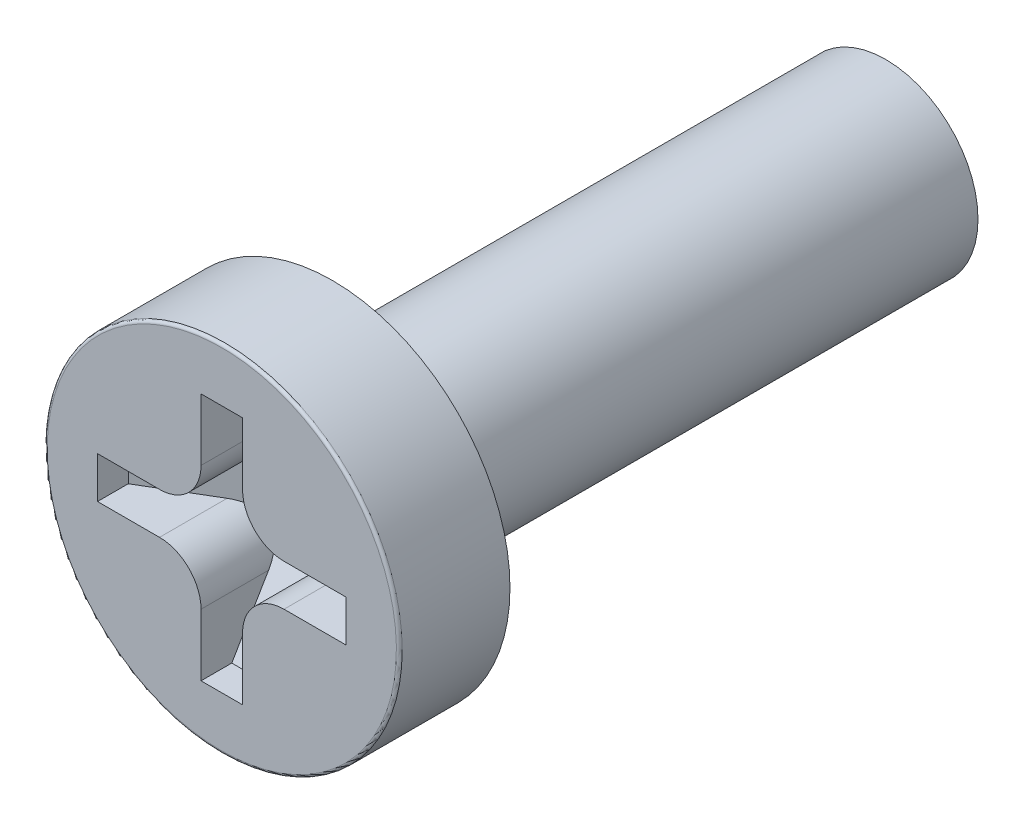
from build123d import *

# Parameters (mm, degrees)
SKETCH_1_W          = 1.925
SKETCH_1_H          = 1.2
CUT_EXTRUDE_1_DEPTH = 1
SKETCH_3_W          = 0.8975
SKETCH_3_H          = 0.13363029
EXTRUDE_1_DEPTH     = 0.45
SKETCH_4_W          = 0.13363029
SKETCH_4_H          = 0.8975
EXTRUDE_2_DEPTH     = 0.45
SKETCH_5_W          = 0.8975
SKETCH_5_H          = 0.13363029
EXTRUDE_3_DEPTH     = 0.45
SKETCH_6_W          = 0.13363029
SKETCH_6_H          = 0.8975
EXTRUDE_4_DEPTH     = 0.45
SKETCH_7_R          = 1
EXTRUDE_5_DEPTH     = 6
DRAFT_1_ANGLE       = 30.706601503
DRAFT_2_ANGLE       = 30.706601503
DRAFT_3_ANGLE       = 30.706601503
DRAFT_4_ANGLE       = 30.706601503
FILLET_1_R          = 0.031496063
FILLET_2_R          = 0.45


with BuildPart() as part:
    # 草图1 → 旋转1 (revolve)
    with BuildSketch(Plane.XZ, mode=Mode.PRIVATE) as revolve_1_sk:
        with Locations((0.9625, 0.6)):
            Rectangle(SKETCH_1_W, SKETCH_1_H)
    revolve(revolve_1_sk.sketch.rotate(Axis((0, 0, 1.2), (0, 0, -1)), 270), axis=Axis((0, 0, 1.2), (0, 0, -1)))

    # 草图2 → 切除-拉伸1 (cut)
    with BuildSketch(Plane.XY.offset(1.2)):
        Polygon((0.225, 1.3475), (-0.225, 1.3475), (-0.225, 0.225), (-1.3475, 0.225), (-1.3475, -0.225), (-0.225, -0.225), (-0.225, -1.3475), (0.225, -1.3475), (0.225, -0.225), (1.3475, -0.225), (1.3475, 0.225), (0.225, 0.225), align=None)
    extrude(amount=-CUT_EXTRUDE_1_DEPTH, mode=Mode.SUBTRACT)

    # 草图3 → 凸台-拉伸1 (add)
    with BuildSketch(Plane.XZ.offset(-0.225)):
        with Locations((-0.89875, 0.266815145)):
            Rectangle(SKETCH_3_W, SKETCH_3_H)
    extrude(amount=EXTRUDE_1_DEPTH)

    # 草图4 → 凸台-拉伸2 (add)
    with BuildSketch(Plane(origin=(-0.225, 0, 0), x_dir=(0, 0, -1), z_dir=(1, 0, 0))):
        with Locations((-0.266815145, 0.89875)):
            Rectangle(SKETCH_4_W, SKETCH_4_H)
    extrude(amount=EXTRUDE_2_DEPTH)

    # 草图5 → 凸台-拉伸3 (add)
    with BuildSketch(Plane.XZ.offset(-0.225)):
        with Locations((0.89875, 0.266815145)):
            Rectangle(SKETCH_5_W, SKETCH_5_H)
    extrude(amount=EXTRUDE_3_DEPTH)

    # 草图6 → 凸台-拉伸4 (add)
    with BuildSketch(Plane(origin=(-0.225, 0, 0), x_dir=(0, 0, -1), z_dir=(1, 0, 0))):
        with Locations((-0.266815145, -0.89875)):
            Rectangle(SKETCH_6_W, SKETCH_6_H)
    extrude(amount=EXTRUDE_4_DEPTH)

    # 草图7 → 凸台-拉伸5 (add)
    with BuildSketch(Plane(origin=(0, 0, 0), x_dir=(-1, 0, 0), z_dir=(0, 0, -1))):
        with Locations(Location((0, 0, 0), (0, 0, 90))):
            Circle(SKETCH_7_R)
    extrude(amount=EXTRUDE_5_DEPTH)

    # 拔模1
    draft_1_faces = [part.faces().sort_by_distance(p)[0] for p in [
        (0, 0.89875, 0.33363029),
    ]]
    draft(draft_1_faces, Plane(origin=(0.225, 0.45, 0.2), x_dir=(0, 0, -1), z_dir=(0, -1, 0)), DRAFT_1_ANGLE)

    # 拔模2
    draft_2_faces = [part.faces().sort_by_distance(p)[0] for p in [
        (0.89875, 0, 0.33363029),
    ]]
    draft(draft_2_faces, Plane(origin=(0.45, -0.225, 0.2), x_dir=(0, 0, -1), z_dir=(-1, 0, 0)), DRAFT_2_ANGLE)

    # 拔模3
    draft_3_faces = [part.faces().sort_by_distance(p)[0] for p in [
        (0, -0.89875, 0.33363029),
    ]]
    draft(draft_3_faces, Plane(origin=(0.225, -0.45, 0.33363029), x_dir=(0, 0, 1), z_dir=(0, 1, 0)), DRAFT_3_ANGLE)

    # 拔模4
    draft_4_faces = [part.faces().sort_by_distance(p)[0] for p in [
        (-0.89875, 0, 0.33363029),
    ]]
    draft(draft_4_faces, Plane(origin=(-0.45, -0.225, 0.33363029), x_dir=(0, 0, 1), z_dir=(1, 0, 0)), DRAFT_4_ANGLE)

    # 圆角1
    fillet_1_edges = [part.edges().sort_by_distance(p)[0] for p in [
        (0, -1.925, 1.2),
    ]]
    fillet(fillet_1_edges, radius=FILLET_1_R)

    # 圆角2
    # the kernel refuses this fillet: 0.45 mm, written as the material it takes off along each edge
    with BuildSketch(Plane(origin=(0.225, 0.225, 2.325), x_dir=(0, 1, 0), z_dir=(0, 0, -1))) as fillet_2_piece_1_section:
        with BuildLine():
            CenterArc((FILLET_2_R, FILLET_2_R), FILLET_2_R, 180, 90)
            Line((0, FILLET_2_R), (0, 0))
            Line((0, 0), (FILLET_2_R, 0))
        make_face()
    fillet_2_piece_1 = extrude(amount=3.25, mode=Mode.PRIVATE)
    fillet_2_piece_1 = split(fillet_2_piece_1, bisect_by=Plane(origin=(0.243098692, 0.68726219, 0.474543246), z_dir=(0, -0.5106419849565733, 0.8597934421706244)), keep=Keep.TOP, mode=Mode.PRIVATE)
    fillet_2_piece_1 = split(fillet_2_piece_1, bisect_by=Plane(origin=(0.45, 0.504131357, 0.782889786), z_dir=(-1, 0, 0)), keep=Keep.TOP, mode=Mode.PRIVATE)
    add(fillet_2_piece_1, mode=Mode.SUBTRACT)
    with BuildSketch(Plane(origin=(0.225, 0.225, 2.325), x_dir=(0, 1, 0), z_dir=(0, 0, -1))) as fillet_2_piece_2_section:
        with BuildLine():
            CenterArc((FILLET_2_R, FILLET_2_R), FILLET_2_R, 180, 90)
            Line((0, FILLET_2_R), (0, 0))
            Line((0, 0), (FILLET_2_R, 0))
        make_face()
    fillet_2_piece_2 = extrude(amount=3.25, mode=Mode.PRIVATE)
    fillet_2_piece_2 = split(fillet_2_piece_2, bisect_by=Plane(origin=(0.504131356, 0.45, 0.782889786), z_dir=(0, -1, 0)), keep=Keep.TOP, mode=Mode.PRIVATE)
    fillet_2_piece_2 = split(fillet_2_piece_2, bisect_by=Plane(origin=(0.68726219, 0.243098692, 0.474543246), z_dir=(-0.5106419849565748, 0, 0.8597934421706236)), keep=Keep.TOP, mode=Mode.PRIVATE)
    add(fillet_2_piece_2, mode=Mode.SUBTRACT)
    with BuildSketch(Plane(origin=(0.225, 0.225, 2.325), x_dir=(0, 1, 0), z_dir=(0, 0, -1))) as fillet_2_piece_3_section:
        with BuildLine():
            CenterArc((FILLET_2_R, FILLET_2_R), FILLET_2_R, 180, 90)
            Line((0, FILLET_2_R), (0, 0))
            Line((0, 0), (FILLET_2_R, 0))
        make_face()
    fillet_2_piece_3 = extrude(amount=2.125, mode=Mode.PRIVATE)
    fillet_2_piece_3 = split(fillet_2_piece_3, bisect_by=Plane(origin=(0.325721218, 0.45, 0.219864503), z_dir=(0, -1, 0)), keep=Keep.TOP, mode=Mode.PRIVATE)
    fillet_2_piece_3 = split(fillet_2_piece_3, bisect_by=Plane(origin=(0.45, 0.325721218, 0.219864503), z_dir=(-1, 0, 0)), keep=Keep.TOP, mode=Mode.PRIVATE)
    add(fillet_2_piece_3, mode=Mode.SUBTRACT)
    with BuildSketch(Plane(origin=(0.225, -0.225, 2.325), x_dir=(1, 0, 0), z_dir=(0, 0, -1))) as fillet_2_piece_4_section:
        with BuildLine():
            CenterArc((FILLET_2_R, FILLET_2_R), FILLET_2_R, 180, 90)
            Line((0, FILLET_2_R), (0, 0))
            Line((0, 0), (FILLET_2_R, 0))
        make_face()
    fillet_2_piece_4 = extrude(amount=3.25, mode=Mode.PRIVATE)
    fillet_2_piece_4 = split(fillet_2_piece_4, bisect_by=Plane(origin=(0.68726219, -0.243098692, 0.474543246), z_dir=(-0.5106419849565748, 0, 0.8597934421706236)), keep=Keep.TOP, mode=Mode.PRIVATE)
    fillet_2_piece_4 = split(fillet_2_piece_4, bisect_by=Plane(origin=(0.504131357, -0.45, 0.782889786), z_dir=(0, 1, 0)), keep=Keep.TOP, mode=Mode.PRIVATE)
    add(fillet_2_piece_4, mode=Mode.SUBTRACT)
    with BuildSketch(Plane(origin=(0.225, -0.225, 2.325), x_dir=(1, 0, 0), z_dir=(0, 0, -1))) as fillet_2_piece_5_section:
        with BuildLine():
            CenterArc((FILLET_2_R, FILLET_2_R), FILLET_2_R, 180, 90)
            Line((0, FILLET_2_R), (0, 0))
            Line((0, 0), (FILLET_2_R, 0))
        make_face()
    fillet_2_piece_5 = extrude(amount=3.25, mode=Mode.PRIVATE)
    fillet_2_piece_5 = split(fillet_2_piece_5, bisect_by=Plane(origin=(0.45, -0.504131356, 0.782889786), z_dir=(-1, 0, 0)), keep=Keep.TOP, mode=Mode.PRIVATE)
    fillet_2_piece_5 = split(fillet_2_piece_5, bisect_by=Plane(origin=(0.243098692, -0.68726219, 0.474543246), z_dir=(0, 0.5106419849565746, 0.8597934421706236)), keep=Keep.TOP, mode=Mode.PRIVATE)
    add(fillet_2_piece_5, mode=Mode.SUBTRACT)
    with BuildSketch(Plane(origin=(0.225, -0.225, 2.325), x_dir=(1, 0, 0), z_dir=(0, 0, -1))) as fillet_2_piece_6_section:
        with BuildLine():
            CenterArc((FILLET_2_R, FILLET_2_R), FILLET_2_R, 180, 90)
            Line((0, FILLET_2_R), (0, 0))
            Line((0, 0), (FILLET_2_R, 0))
        make_face()
    fillet_2_piece_6 = extrude(amount=2.125, mode=Mode.PRIVATE)
    fillet_2_piece_6 = split(fillet_2_piece_6, bisect_by=Plane(origin=(0.45, -0.325721218, 0.219864503), z_dir=(-1, 0, 0)), keep=Keep.TOP, mode=Mode.PRIVATE)
    fillet_2_piece_6 = split(fillet_2_piece_6, bisect_by=Plane(origin=(0.325721218, -0.45, 0.219864503), z_dir=(0, 1, 0)), keep=Keep.TOP, mode=Mode.PRIVATE)
    add(fillet_2_piece_6, mode=Mode.SUBTRACT)
    with BuildSketch(Plane(origin=(-0.225, 0.225, 2.325), x_dir=(-1, 0, 0), z_dir=(0, 0, -1))) as fillet_2_piece_7_section:
        with BuildLine():
            CenterArc((FILLET_2_R, FILLET_2_R), FILLET_2_R, 180, 90)
            Line((0, FILLET_2_R), (0, 0))
            Line((0, 0), (FILLET_2_R, 0))
        make_face()
    fillet_2_piece_7 = extrude(amount=3.25, mode=Mode.PRIVATE)
    fillet_2_piece_7 = split(fillet_2_piece_7, bisect_by=Plane(origin=(-0.504131357, 0.45, 0.782889786), z_dir=(0, -1, 0)), keep=Keep.TOP, mode=Mode.PRIVATE)
    fillet_2_piece_7 = split(fillet_2_piece_7, bisect_by=Plane(origin=(-0.68726219, 0.243098692, 0.474543246), z_dir=(0.5106419849565733, 0, 0.8597934421706244)), keep=Keep.TOP, mode=Mode.PRIVATE)
    add(fillet_2_piece_7, mode=Mode.SUBTRACT)
    with BuildSketch(Plane(origin=(-0.225, 0.225, 2.325), x_dir=(-1, 0, 0), z_dir=(0, 0, -1))) as fillet_2_piece_8_section:
        with BuildLine():
            CenterArc((FILLET_2_R, FILLET_2_R), FILLET_2_R, 180, 90)
            Line((0, FILLET_2_R), (0, 0))
            Line((0, 0), (FILLET_2_R, 0))
        make_face()
    fillet_2_piece_8 = extrude(amount=3.25, mode=Mode.PRIVATE)
    fillet_2_piece_8 = split(fillet_2_piece_8, bisect_by=Plane(origin=(-0.243098692, 0.68726219, 0.474543246), z_dir=(0, -0.5106419849565733, 0.8597934421706244)), keep=Keep.TOP, mode=Mode.PRIVATE)
    fillet_2_piece_8 = split(fillet_2_piece_8, bisect_by=Plane(origin=(-0.45, 0.504131356, 0.782889786), z_dir=(1, 0, 0)), keep=Keep.TOP, mode=Mode.PRIVATE)
    add(fillet_2_piece_8, mode=Mode.SUBTRACT)
    with BuildSketch(Plane(origin=(-0.225, 0.225, 2.325), x_dir=(-1, 0, 0), z_dir=(0, 0, -1))) as fillet_2_piece_9_section:
        with BuildLine():
            CenterArc((FILLET_2_R, FILLET_2_R), FILLET_2_R, 180, 90)
            Line((0, FILLET_2_R), (0, 0))
            Line((0, 0), (FILLET_2_R, 0))
        make_face()
    fillet_2_piece_9 = extrude(amount=2.125, mode=Mode.PRIVATE)
    fillet_2_piece_9 = split(fillet_2_piece_9, bisect_by=Plane(origin=(-0.325721218, 0.45, 0.219864503), z_dir=(0, -1, 0)), keep=Keep.TOP, mode=Mode.PRIVATE)
    fillet_2_piece_9 = split(fillet_2_piece_9, bisect_by=Plane(origin=(-0.45, 0.325721218, 0.219864503), z_dir=(1, 0, 0)), keep=Keep.TOP, mode=Mode.PRIVATE)
    add(fillet_2_piece_9, mode=Mode.SUBTRACT)
    with BuildSketch(Plane(origin=(-0.225, -0.225, 2.325), x_dir=(0, -1, 0), z_dir=(0, 0, -1))) as fillet_2_piece_10_section:
        with BuildLine():
            CenterArc((FILLET_2_R, FILLET_2_R), FILLET_2_R, 180, 90)
            Line((0, FILLET_2_R), (0, 0))
            Line((0, 0), (FILLET_2_R, 0))
        make_face()
    fillet_2_piece_10 = extrude(amount=3.25, mode=Mode.PRIVATE)
    fillet_2_piece_10 = split(fillet_2_piece_10, bisect_by=Plane(origin=(-0.243098692, -0.68726219, 0.474543246), z_dir=(0, 0.5106419849565746, 0.8597934421706236)), keep=Keep.TOP, mode=Mode.PRIVATE)
    fillet_2_piece_10 = split(fillet_2_piece_10, bisect_by=Plane(origin=(-0.45, -0.504131357, 0.782889786), z_dir=(1, 0, 0)), keep=Keep.TOP, mode=Mode.PRIVATE)
    add(fillet_2_piece_10, mode=Mode.SUBTRACT)
    with BuildSketch(Plane(origin=(-0.225, -0.225, 2.325), x_dir=(0, -1, 0), z_dir=(0, 0, -1))) as fillet_2_piece_11_section:
        with BuildLine():
            CenterArc((FILLET_2_R, FILLET_2_R), FILLET_2_R, 180, 90)
            Line((0, FILLET_2_R), (0, 0))
            Line((0, 0), (FILLET_2_R, 0))
        make_face()
    fillet_2_piece_11 = extrude(amount=3.25, mode=Mode.PRIVATE)
    fillet_2_piece_11 = split(fillet_2_piece_11, bisect_by=Plane(origin=(-0.504131356, -0.45, 0.782889786), z_dir=(0, 1, 0)), keep=Keep.TOP, mode=Mode.PRIVATE)
    fillet_2_piece_11 = split(fillet_2_piece_11, bisect_by=Plane(origin=(-0.68726219, -0.243098692, 0.474543246), z_dir=(0.5106419849565733, 0, 0.8597934421706244)), keep=Keep.TOP, mode=Mode.PRIVATE)
    add(fillet_2_piece_11, mode=Mode.SUBTRACT)
    with BuildSketch(Plane(origin=(-0.225, -0.225, 2.325), x_dir=(0, -1, 0), z_dir=(0, 0, -1))) as fillet_2_piece_12_section:
        with BuildLine():
            CenterArc((FILLET_2_R, FILLET_2_R), FILLET_2_R, 180, 90)
            Line((0, FILLET_2_R), (0, 0))
            Line((0, 0), (FILLET_2_R, 0))
        make_face()
    fillet_2_piece_12 = extrude(amount=2.125, mode=Mode.PRIVATE)
    fillet_2_piece_12 = split(fillet_2_piece_12, bisect_by=Plane(origin=(-0.325721218, -0.45, 0.219864503), z_dir=(0, 1, 0)), keep=Keep.TOP, mode=Mode.PRIVATE)
    fillet_2_piece_12 = split(fillet_2_piece_12, bisect_by=Plane(origin=(-0.45, -0.325721218, 0.219864503), z_dir=(1, 0, 0)), keep=Keep.TOP, mode=Mode.PRIVATE)
    add(fillet_2_piece_12, mode=Mode.SUBTRACT)


solid = part.part
